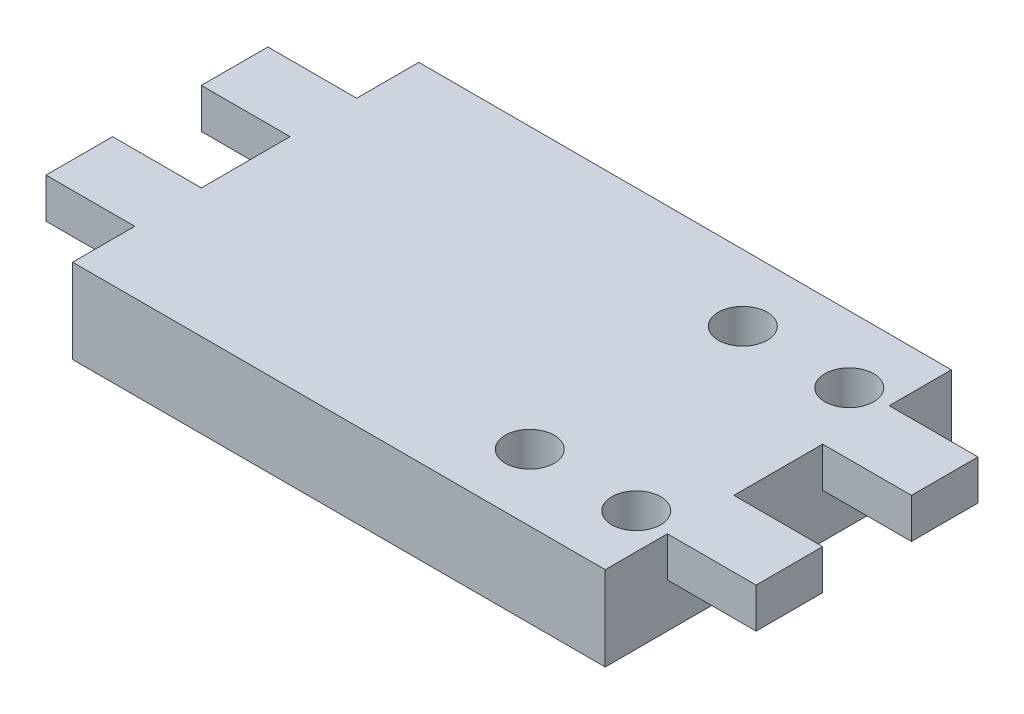
from build123d import *

# Parameters (mm, degrees)
SKETCH1_W                       = 25
SKETCH1_H                       = 4.5
BOSS_EXTRUDE1_DEPTH             = 30
SKETCH2_W                       = 7.5
SKETCH2_H                       = 4.5
BOSS_EXTRUDE2_DEPTH             = 10
ESQUISSE1_W                     = 60
ESQUISSE1_H                     = 4.5
BOSS_EXTRU_1_DEPTH              = 7
SKETCH6_W                       = 60
SKETCH6_H                       = 39
BOSS_EXTRUDE3_DEPTH             = 5
CBORE_FOR_M3_SBHCS2_D           = 2.8
CBORE_FOR_M3_SBHCS2_CBORE_D     = 5.5
CBORE_FOR_M3_SBHCS2_CBORE_DEPTH = 8.1


with BuildPart() as part:
    # Sketch1 → Boss-Extrude1 (new, symmetric)
    with BuildSketch(Plane(origin=(0, 0, 0), x_dir=(0, 0, -1), z_dir=(1, 0, 0))):
        Rectangle(SKETCH1_W, SKETCH1_H)
    extrude(amount=BOSS_EXTRUDE1_DEPTH, both=True)

    # Sketch2 → Boss-Extrude2 (add)
    with BuildSketch(Plane(origin=(30, 0, 0), x_dir=(0, 0, -1), z_dir=(1, 0, 0))):
        with Locations((-8.75, 0)):
            Rectangle(SKETCH2_W, SKETCH2_H)
        with Locations((8.75, 0)):
            Rectangle(SKETCH2_W, SKETCH2_H)
    boss_extrude2 = extrude(amount=BOSS_EXTRUDE2_DEPTH)

    # Esquisse1 → Boss.-Extru.1 (add)
    with BuildSketch(Plane.XY.offset(12.5)):
        Rectangle(ESQUISSE1_W, ESQUISSE1_H)
    boss_extru_1 = extrude(amount=BOSS_EXTRU_1_DEPTH)

    # Symétrie1: Boss.-Extru.1 across plane
    add(boss_extru_1.mirror(Plane.XY))

    # Mirror1: Boss-Extrude2 across plane
    add(boss_extrude2.mirror(Plane(origin=(0, 0, 0), x_dir=(0, 0, 1), z_dir=(1, 0, 0))))

    # Sketch6 → Boss-Extrude3 (add)
    with BuildSketch(Plane.XZ.offset(2.25)):
        Rectangle(SKETCH6_W, SKETCH6_H)
    extrude(amount=BOSS_EXTRUDE3_DEPTH)

    # CBORE for M3 SBHCS2 (through all)
    with Locations(Plane(origin=(0, 2.25, 0), x_dir=(-1, 0, 0), z_dir=(0, 1, 0))):
        with Locations((-26, -12), (-14, -12), (-14, 12), (-26, 12)):
            CounterBoreHole(CBORE_FOR_M3_SBHCS2_D / 2, CBORE_FOR_M3_SBHCS2_CBORE_D / 2, CBORE_FOR_M3_SBHCS2_CBORE_DEPTH)


solid = part.part
